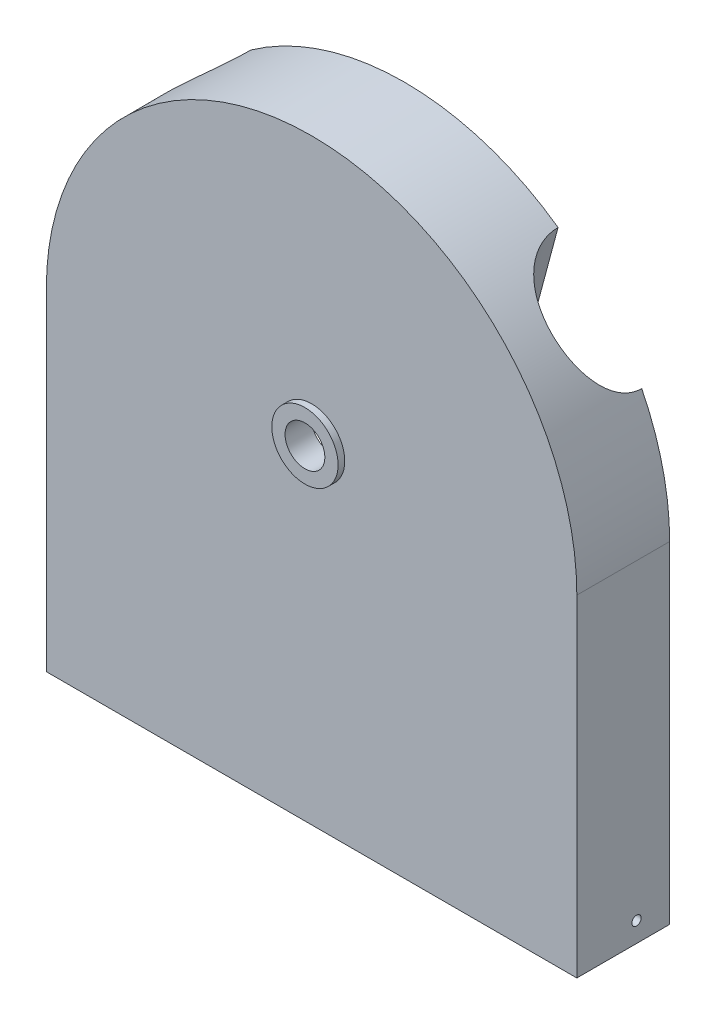
from build123d import *
from build123d.topology import SkipClean

# Parameters (mm, degrees)
BOSS_EXTRUDE4_DEPTH             = 70
F_1_0MM_DOWEL_HOLE1_D           = 30
SKETCH4_R                       = 25
SKETCH4_R_2                     = 15
BOSS_EXTRUDE5_DEPTH             = 5
CUT_EXTRUDE4_DEPTH              = 499.121471129
CUT_EXTRUDE4_DEPTH_BACK         = 499.121471129
CUT_EXTRUDE5_DEPTH              = 55
F_10_0MM_DOWEL_HOLE1_AT_2_COUNT = 2
F_10_0MM_DOWEL_HOLE1_AT_2_PITCH = 155.724133524
F_10_0MM_DOWEL_HOLE1_AT_3_COUNT = 2
F_10_0MM_DOWEL_HOLE1_AT_3_PITCH = 183.115416505
CUT_EXTRUDE6_REACH              = 547.552
SKETCH22_R                      = 40


with BuildPart() as part:
    # Sketch2 → Boss-Extrude4 (new, symmetric)
    with BuildSketch(Plane.XY):
        with BuildLine():
            Line((-200, 0), (200, 0))
            Line((200, 0), (200, 250))
            ThreePointArc((200, 250), (0, 450), (-200, 250))
            Line((-200, 250), (-200, 0))
        make_face()
    extrude(amount=BOSS_EXTRUDE4_DEPTH, both=True)

    # Ø1.0mm Dowel Hole1 (through all)
    with Locations(Plane(origin=(0, 250, 70), x_dir=(1, 0, 0), z_dir=(0, 0, 1))):
        with Locations((0, 0)):
            Hole(F_1_0MM_DOWEL_HOLE1_D / 2)

    # Sketch4 → Boss-Extrude5 (add)
    with SkipClean():  # the faces are left unmerged after this step: merging them gives an invalid solid
        with BuildSketch(Plane.XY.offset(70)):
            with Locations((0, 250)):
                Circle(SKETCH4_R)
            with Locations((0, 250)):
                Circle(SKETCH4_R_2, mode=Mode.SUBTRACT)
        extrude(amount=BOSS_EXTRUDE5_DEPTH)
    add(part.part.scale(1), mode=Mode.REPLACE)  # the faces are merged on a copy

    # Sketch13 → Cut-Extrude4 (cut, two sides: drawn at the far end of the back side and taken through both)
    with BuildSketch(Plane(origin=(0, 0, 0), x_dir=(0, 0, -1), z_dir=(1, 0, 0)).offset(-CUT_EXTRUDE4_DEPTH_BACK)):
        Polygon((0, -922.414379545), (0, 0), (0, 450), (0, 1372.414379545), (1844.828759089, 1372.414379545), (1844.828759089, -922.414379545), align=None)
    extrude(amount=CUT_EXTRUDE4_DEPTH + CUT_EXTRUDE4_DEPTH_BACK, mode=Mode.SUBTRACT)

    # Sketch14 → Cut-Extrude5 (cut)
    with BuildSketch(Plane(origin=(0, 0, 0), x_dir=(-1, 0, 0), z_dir=(0, 0, -1))):
        with BuildLine():
            Line((-185, 45), (-185, 200))
            ThreePointArc((-185, 200), (-182.128554255, 215.817234791), (-173.880670381, 229.615877068))
            Line((-173.880670381, 229.615877068), (-88.466194885, 327.330345677))
            ThreePointArc((-88.466194885, 327.330345677), (-70.735263863, 343.823091221), (-49.999974949, 356.330863371))
            Line((-49.999974949, 356.330863371), (-49.999974949, 420.000023858))
            ThreePointArc((-49.999974949, 420.000023858), (0, 440), (49.999974949, 420.000023858))
            Line((49.999974949, 420.000023858), (49.999974949, 356.330863371))
            ThreePointArc((49.999974949, 356.330863371), (70.735263863, 343.823091221), (88.466194885, 327.330345677))
            Line((88.466194885, 327.330345677), (173.880670381, 229.615877068))
            ThreePointArc((173.880670381, 229.615877068), (182.128554255, 215.817234791), (185, 200))
            Line((185, 200), (185, 45))
            Line((185, 45), (178.301270189, 20))
            Line((178.301270189, 20), (178.301270189, 0))
            Line((178.301270189, 0), (-178.301270189, 0))
            Line((-178.301270189, 0), (-178.301270189, 20))
            Line((-178.301270189, 20), (-185, 45))
        make_face()
    extrude(amount=-CUT_EXTRUDE5_DEPTH, mode=Mode.SUBTRACT)

    # Sketch18 → M8x1.0 Tapped Hole1 (revolve, cut)
    with BuildSketch(Plane(origin=(-200, 15, 25), x_dir=(0, 0, 1), z_dir=(0, 1, 0))):
        Polygon((0, 0), (0, 13.103012167), (3.5, 11), (3.5, 0), align=None)
    m8x1_0_tapped_hole1 = revolve(axis=Axis((-206.35, 15, 25), (1, 0, 0)), mode=Mode.SUBTRACT)

    # Mirror2: M8x1.0 Tapped Hole1 across plane
    add(m8x1_0_tapped_hole1.mirror(Plane(origin=(0, 0, 0), x_dir=(0, 0, 1), z_dir=(1, 0, 0))), mode=Mode.SUBTRACT)

    # Sketch21 → Ø10.0mm Dowel Hole1 (revolve, cut)
    with BuildSketch(Plane(origin=(185, 265, 0), x_dir=(0, 1, 0), z_dir=(1, 0, 0))):
        Polygon((0, 0), (0, 50), (5, 45), (5, 0), align=None)
    f_10_0mm_dowel_hole1 = revolve(axis=Axis((185, 265, -6.35), (0, 0, 1)), mode=Mode.SUBTRACT)

    # Ø10.0mm Dowel Hole1 at 2: Ø10.0mm Dowel Hole1 ×2
    with Locations(*[Vector(-0.7384855670659363, 0.6742692839180076, 0) * (i * F_10_0MM_DOWEL_HOLE1_AT_2_PITCH) for i in range(1, F_10_0MM_DOWEL_HOLE1_AT_2_COUNT)]):
        add(f_10_0mm_dowel_hole1, mode=Mode.SUBTRACT)

    # Ø10.0mm Dowel Hole1 at 3: Ø10.0mm Dowel Hole1 ×2
    with Locations(*[Vector(-0.6280193511079233, 0.7781977220693871, 0) * (i * F_10_0MM_DOWEL_HOLE1_AT_3_PITCH) for i in range(1, F_10_0MM_DOWEL_HOLE1_AT_3_COUNT)]):
        add(f_10_0mm_dowel_hole1, mode=Mode.SUBTRACT)

    # Mirror3: Ø10.0mm Dowel Hole1 across plane
    add(f_10_0mm_dowel_hole1.mirror(Plane(origin=(0, 0, 0), x_dir=(0, 0, 1), z_dir=(1, 0, 0))), mode=Mode.SUBTRACT)

    # Mirror3 copy 1 sketch → Mirror3 copy 1 (revolve, cut)
    with BuildSketch(Plane(origin=(-69.999974949, 370, 0), x_dir=(0, 1, 0), z_dir=(-1, 0, 0))):
        Polygon((0, 0), (0, -50), (5, -45), (5, 0), align=None)
    revolve(axis=Axis((-69.999974949, 370, -6.35), (0, 0, -1)), mode=Mode.SUBTRACT)

    # Mirror3 copy 2 sketch → Mirror3 copy 2 (revolve, cut)
    with BuildSketch(Plane(origin=(-69.999974949, 407.5, 0), x_dir=(0, 1, 0), z_dir=(-1, 0, 0))):
        Polygon((0, 0), (0, -50), (5, -45), (5, 0), align=None)
    revolve(axis=Axis((-69.999974949, 407.5, -6.35), (0, 0, -1)), mode=Mode.SUBTRACT)

    # Cut-Extrude6: up to this plane
    cut_extrude6_end = Plane(origin=(-200, 0, 70), z_dir=(0, 1, 0))
    # Sketch22 → Cut-Extrude6 (cut, up to the surface)
    with BuildSketch(Plane(origin=(-114.263809021, 426.438340731, 0), x_dir=(0, 0, -1), z_dir=(-0.25881904510252135, 0.9659258262890681, 0)), mode=Mode.PRIVATE) as cut_extrude6_sk1:
        with Locations((0, 45)):
            Circle(SKETCH22_R)
    cut_extrude6_tool1 = split(extrude(cut_extrude6_sk1.sketch, amount=-CUT_EXTRUDE6_REACH, mode=Mode.PRIVATE), bisect_by=cut_extrude6_end, keep=Keep.BOTH, mode=Mode.PRIVATE)
    cut_extrude6 = cut_extrude6_tool1.solids().sort_by_distance((-157.730471, 414.791484, 0))[0]
    add(cut_extrude6, mode=Mode.SUBTRACT)

    # Mirror4: Cut-Extrude6 across plane
    add(cut_extrude6.mirror(Plane(origin=(0, 0, 0), x_dir=(0, 0, 1), z_dir=(1, 0, 0))), mode=Mode.SUBTRACT)


solid = part.part
